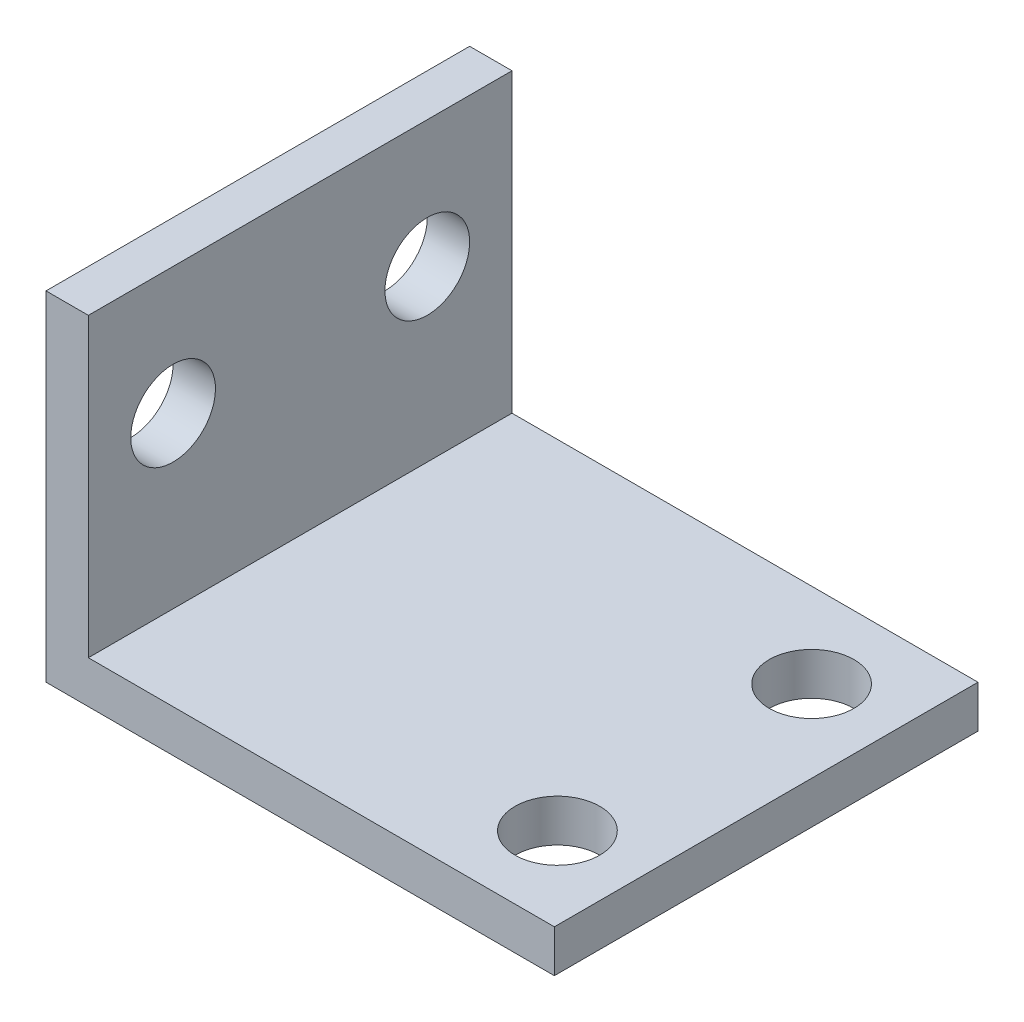
from build123d import *

# Parameters (mm, degrees)
BOSS_EXTRUDE1_DEPTH = 31.75
SKETCH2_R           = 3.175
CUT_EXTRUDE1_DEPTH  = 55.34724579
SKETCH3_R           = 3.175
CUT_EXTRUDE2_DEPTH  = 54.600169076


with BuildPart() as part:
    # Sketch1 → Boss-Extrude1 (new body)
    with BuildSketch(Plane.XY):
        Polygon((0, 0), (0, 25.4), (3.175, 25.4), (3.175, 3.175), (38.1, 3.175), (38.1, 0), align=None)
    extrude(amount=BOSS_EXTRUDE1_DEPTH)

    # Sketch2 → Cut-Extrude1 (cut, through all)
    with BuildSketch(Plane(origin=(0, 3.175, 0), x_dir=(1, 0, 0), z_dir=(0, 1, 0))):
        with Locations((31.9786, -6.35)):
            Circle(SKETCH2_R)
        with Locations((31.9786, -25.4)):
            Circle(SKETCH2_R)
    extrude(amount=-CUT_EXTRUDE1_DEPTH, mode=Mode.SUBTRACT)

    # Sketch3 → Cut-Extrude2 (cut, through all)
    with BuildSketch(Plane(origin=(3.175, 0, 0), x_dir=(0, 0, -1), z_dir=(1, 0, 0))):
        with Locations((-25.4, 15.875)):
            Circle(SKETCH3_R)
        with Locations((-6.35, 15.875)):
            Circle(SKETCH3_R)
    extrude(amount=-CUT_EXTRUDE2_DEPTH, mode=Mode.SUBTRACT)


solid = part.part
